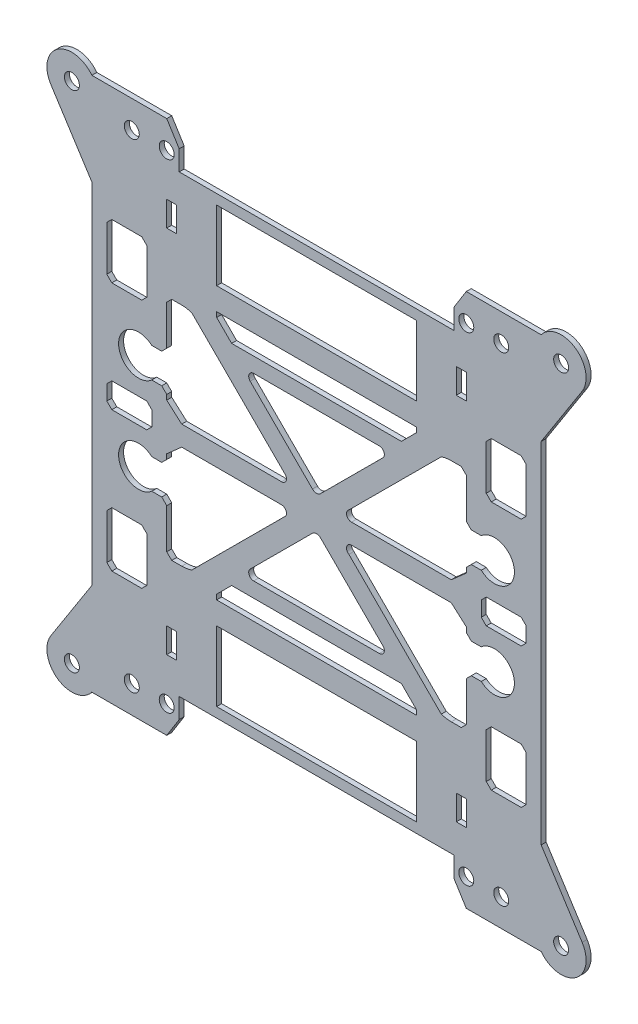
from build123d import *

# Parameters (mm, degrees)
CROQUIS1_R              = 1.5
CROQUIS1_W              = 2
CROQUIS1_H              = 5
SALIENTE_EXTRUIR1_DEPTH = 1
SIMETR_A1_OUTLINE_R     = 1.5
SIMETR_A1_OUTLINE_W     = 2
SIMETR_A1_OUTLINE_H     = 5
SIMETR_A1_OUTLINE_W_2   = 40
SIMETR_A1_OUTLINE_H_2   = 14
SIMETR_A1_DEPTH         = 1


# Read off the part's stored shape, not the designer's step: Simetría1
with BuildPart() as part:
    # Croquis1 → Saliente-Extruir1 (new body)
    with BuildSketch(Plane.XY):
        with BuildLine():
            Line((57.948777513, 9.552803084), (85.448777513, 9.552803084))
            Line((85.448777513, 9.552803084), (85.448777513, 5.552803084))
            Line((85.448777513, 5.552803084), (87.948777513, 1.552803084))
            Line((87.948777513, 1.552803084), (102.948777513, 1.552803084))
            ThreePointArc((102.948777513, 1.552803084), (109.800229319, 0.445587166), (111.157695524, 7.2518787))
            Line((111.157695524, 7.2518787), (102.948777513, 20.052803084))
            Line((102.948777513, 20.052803084), (102.948777513, 55.052803084))
            Line((102.948777513, 55.052803084), (99.948777513, 55.052803084))
            Line((99.948777513, 55.052803084), (99.948777513, 53.552803084))
            Line((99.948777513, 53.552803084), (98.948777513, 52.552803084))
            Line((98.948777513, 52.552803084), (91.948777513, 52.552803084))
            Line((91.948777513, 52.552803084), (90.948777513, 53.552803084))
            Line((90.948777513, 53.552803084), (90.948777513, 55.052803084))
            Line((90.948777513, 55.052803084), (57.948777513, 55.052803084))
            Line((57.948777513, 55.052803084), (57.948777513, 52.052803084))
            Line((57.948777513, 52.052803084), (57.948777513, 51.552803084))
            ThreePointArc((57.948777513, 51.552803084), (58.384311078, 51.466281891), (58.753703167, 51.219857688))
            Line((58.753703167, 51.219857688), (71.237594793, 38.76060809))
            ThreePointArc((71.237594793, 38.76060809), (71.455255379, 37.670576061), (70.531186927, 37.052803084))
            Line((70.531186927, 37.052803084), (57.948777513, 37.052803084))
            Line((57.948777513, 37.052803084), (57.948777513, 34.052803084))
            Line((57.948777513, 34.052803084), (74.948777513, 34.052803084))
            Line((74.948777513, 34.052803084), (77.948777513, 31.052803084))
            Line((77.948777513, 31.052803084), (77.948777513, 30.052803084))
            Line((77.948777513, 30.052803084), (57.948777513, 30.052803084))
            Line((57.948777513, 30.052803084), (57.948777513, 25.552803084))
            Line((57.948777513, 25.552803084), (77.948777513, 25.552803084))
            Line((77.948777513, 25.552803084), (77.948777513, 11.552803084))
            Line((77.948777513, 11.552803084), (57.948777513, 11.552803084))
            Line((57.948777513, 11.552803084), (57.948777513, 9.552803084))
        make_face()
        with Locations((87.948777513, 7.052803084)):
            Circle(CROQUIS1_R, mode=Mode.SUBTRACT)
        with Locations((94.948777513, 7.052803084)):
            Circle(CROQUIS1_R, mode=Mode.SUBTRACT)
        with Locations((106.948777513, 4.552803084)):
            Circle(CROQUIS1_R, mode=Mode.SUBTRACT)
        with BuildLine():
            Line((64.948777513, 53.052803084), (84.948777513, 53.052803084))
            Line((84.948777513, 53.052803084), (87.948777513, 50.407051773))
            Line((87.948777513, 50.407051773), (87.948777513, 49.407051773))
            Line((87.948777513, 49.407051773), (88.948777513, 48.407051773))
            Line((88.948777513, 48.407051773), (90.948777513, 48.407051773))
            ThreePointArc((90.948777513, 48.407051773), (97.594528824, 45.407051773), (90.948777513, 42.407051773))
            Line((90.948777513, 42.407051773), (88.948777513, 42.407051773))
            Line((88.948777513, 42.407051773), (87.948777513, 41.407051773))
            Line((87.948777513, 41.407051773), (87.948777513, 33.407051773))
            Line((87.948777513, 33.407051773), (86.948777513, 32.407051773))
            Line((86.948777513, 32.407051773), (84.948777513, 32.407051773))
            ThreePointArc((84.948777513, 32.407051773), (83.929476852, 32.489760934), (82.936845688, 32.735724374))
            Line((82.936845688, 32.735724374), (72.293713741, 43.35784778))
            Line((72.293713741, 43.35784778), (67.241774681, 48.399814787))
            Line((67.241774681, 48.399814787), (64.416148734, 51.219863215))
            ThreePointArc((64.416148734, 51.219863215), (63.994397874, 52.336276072), (64.948777513, 53.052803084))
        make_face(mode=Mode.SUBTRACT)
        Polygon((91.948777513, 34.552803084), (92.948777513, 35.552803084), (98.948777513, 35.552803084), (99.948777513, 34.552803084), (99.948777513, 25.552803084), (98.948777513, 24.552803084), (92.948777513, 24.552803084), (91.948777513, 25.552803084), align=None, mode=Mode.SUBTRACT)
        with Locations((86.948777513, 18.052803084)):
            Rectangle(CROQUIS1_W, CROQUIS1_H, mode=Mode.SUBTRACT)
    extrude(amount=SALIENTE_EXTRUIR1_DEPTH)

    # Simetría1 outline → Simetría1 (add)
    with BuildSketch(Plane.XY):
        with BuildLine():
            Line((90.948777513, 55.052803084), (90.948777513, 56.552803084))
            Line((90.948777513, 56.552803084), (91.948777513, 57.552803084))
            Line((91.948777513, 57.552803084), (98.948777513, 57.552803084))
            Line((98.948777513, 57.552803084), (99.948777513, 56.552803084))
            Line((99.948777513, 56.552803084), (99.948777513, 55.052803084))
            Line((99.948777513, 55.052803084), (102.948777513, 55.052803084))
            Line((102.948777513, 55.052803084), (102.948777513, 90.052803084))
            Line((102.948777513, 90.052803084), (111.157695524, 102.853727468))
            ThreePointArc((111.157695524, 102.853727468), (109.800229319, 109.660019002), (102.948777513, 108.552803084))
            Line((102.948777513, 108.552803084), (87.948777513, 108.552803084))
            Line((87.948777513, 108.552803084), (85.448777513, 104.552803084))
            Line((85.448777513, 104.552803084), (85.448777513, 100.552803084))
            Line((85.448777513, 100.552803084), (30.448777513, 100.552803084))
            Line((30.448777513, 100.552803084), (30.448777513, 104.552803084))
            Line((30.448777513, 104.552803084), (27.948777513, 108.552803084))
            Line((27.948777513, 108.552803084), (12.948777513, 108.552803084))
            ThreePointArc((12.948777513, 108.552803084), (6.097325707, 109.660019002), (4.739859502, 102.853727468))
            Line((4.739859502, 102.853727468), (12.948777513, 90.052803084))
            Line((12.948777513, 90.052803084), (12.948777513, 20.052803084))
            Line((12.948777513, 20.052803084), (4.739859502, 7.2518787))
            ThreePointArc((4.739859502, 7.2518787), (6.097325707, 0.445587166), (12.948777513, 1.552803084))
            Line((12.948777513, 1.552803084), (27.948777513, 1.552803084))
            Line((27.948777513, 1.552803084), (30.448777513, 5.552803084))
            Line((30.448777513, 5.552803084), (30.448777513, 9.552803084))
            Line((30.448777513, 9.552803084), (57.948777513, 9.552803084))
            Line((57.948777513, 9.552803084), (57.948777513, 11.552803084))
            Line((57.948777513, 11.552803084), (37.948777513, 11.552803084))
            Line((37.948777513, 11.552803084), (37.948777513, 25.552803084))
            Line((37.948777513, 25.552803084), (57.948777513, 25.552803084))
            Line((57.948777513, 25.552803084), (57.948777513, 30.052803084))
            Line((57.948777513, 30.052803084), (37.948777513, 30.052803084))
            Line((37.948777513, 30.052803084), (37.948777513, 31.052803084))
            Line((37.948777513, 31.052803084), (40.948777513, 34.052803084))
            Line((40.948777513, 34.052803084), (57.948777513, 34.052803084))
            Line((57.948777513, 34.052803084), (57.948777513, 37.052803084))
            Line((57.948777513, 37.052803084), (45.366368099, 37.052803084))
            ThreePointArc((45.366368099, 37.052803084), (44.442299648, 37.670576061), (44.659960233, 38.76060809))
            Line((44.659960233, 38.76060809), (57.143851859, 51.219857688))
            ThreePointArc((57.143851859, 51.219857688), (57.513243948, 51.466281891), (57.948777513, 51.552803084))
            Line((57.948777513, 51.552803084), (57.948777513, 55.052803084))
            Line((57.948777513, 55.052803084), (90.948777513, 55.052803084))
        make_face()
        with Locations((8.948777513, 4.552803084)):
            Circle(SIMETR_A1_OUTLINE_R, mode=Mode.SUBTRACT)
        with Locations((20.948777513, 7.052803084)):
            Circle(SIMETR_A1_OUTLINE_R, mode=Mode.SUBTRACT)
        with Locations((27.948777513, 7.052803084)):
            Circle(SIMETR_A1_OUTLINE_R, mode=Mode.SUBTRACT)
        with Locations((28.948777513, 18.052803084)):
            Rectangle(SIMETR_A1_OUTLINE_W, SIMETR_A1_OUTLINE_H, mode=Mode.SUBTRACT)
        Polygon((22.948777513, 24.552803084), (16.948777513, 24.552803084), (15.948777513, 25.552803084), (15.948777513, 34.552803084), (16.948777513, 35.552803084), (22.948777513, 35.552803084), (23.948777513, 34.552803084), (23.948777513, 25.552803084), align=None, mode=Mode.SUBTRACT)
        Polygon((24.948777513, 53.552803084), (23.948777513, 52.552803084), (16.948777513, 52.552803084), (15.948777513, 53.552803084), (15.948777513, 56.552803084), (16.948777513, 57.552803084), (23.948777513, 57.552803084), (24.948777513, 56.552803084), align=None, mode=Mode.SUBTRACT)
        with BuildLine():
            Line((30.948777513, 32.407051773), (28.948777513, 32.407051773))
            Line((28.948777513, 32.407051773), (27.948777513, 33.407051773))
            Line((27.948777513, 33.407051773), (27.948777513, 41.407051773))
            Line((27.948777513, 41.407051773), (26.948777513, 42.407051773))
            Line((26.948777513, 42.407051773), (24.948777513, 42.407051773))
            ThreePointArc((24.948777513, 42.407051773), (18.303026202, 45.407051773), (24.948777513, 48.407051773))
            Line((24.948777513, 48.407051773), (26.948777513, 48.407051773))
            Line((26.948777513, 48.407051773), (27.948777513, 49.407051773))
            Line((27.948777513, 49.407051773), (27.948777513, 50.407051773))
            Line((27.948777513, 50.407051773), (30.948777513, 53.052803084))
            Line((30.948777513, 53.052803084), (50.948777513, 53.052803084))
            ThreePointArc((50.948777513, 53.052803084), (51.903157152, 52.336276072), (51.481406293, 51.219863215))
            Line((51.481406293, 51.219863215), (32.960709338, 32.735724374))
            ThreePointArc((32.960709338, 32.735724374), (31.968078174, 32.489760934), (30.948777513, 32.407051773))
        make_face(mode=Mode.SUBTRACT)
        Polygon((23.948777513, 75.552803084), (22.948777513, 74.552803084), (16.948777513, 74.552803084), (15.948777513, 75.552803084), (15.948777513, 84.552803084), (16.948777513, 85.552803084), (22.948777513, 85.552803084), (23.948777513, 84.552803084), align=None, mode=Mode.SUBTRACT)
        with BuildLine():
            ThreePointArc((51.481406293, 58.885742953), (51.903157152, 57.769330096), (50.948777513, 57.052803084))
            Line((50.948777513, 57.052803084), (30.948777513, 57.052803084))
            Line((30.948777513, 57.052803084), (27.948777513, 59.698554395))
            Line((27.948777513, 59.698554395), (27.948777513, 60.698554395))
            Line((27.948777513, 60.698554395), (26.948777513, 61.698554395))
            Line((26.948777513, 61.698554395), (24.948777513, 61.698554395))
            ThreePointArc((24.948777513, 61.698554395), (18.303026202, 64.698554395), (24.948777513, 67.698554395))
            Line((24.948777513, 67.698554395), (26.948777513, 67.698554395))
            Line((26.948777513, 67.698554395), (27.948777513, 68.698554395))
            Line((27.948777513, 68.698554395), (27.948777513, 76.698554395))
            Line((27.948777513, 76.698554395), (28.948777513, 77.698554395))
            Line((28.948777513, 77.698554395), (30.948777513, 77.698554395))
            ThreePointArc((30.948777513, 77.698554395), (31.968078174, 77.615845234), (32.960709338, 77.369881793))
            Line((32.960709338, 77.369881793), (51.481406293, 58.885742953))
        make_face(mode=Mode.SUBTRACT)
        with Locations((28.948777513, 92.052803084)):
            Rectangle(SIMETR_A1_OUTLINE_W, SIMETR_A1_OUTLINE_H, mode=Mode.SUBTRACT)
        with Locations((8.948777513, 105.552803084)):
            Circle(SIMETR_A1_OUTLINE_R, mode=Mode.SUBTRACT)
        with Locations((20.948777513, 103.052803084)):
            Circle(SIMETR_A1_OUTLINE_R, mode=Mode.SUBTRACT)
        with Locations((27.948777513, 103.052803084)):
            Circle(SIMETR_A1_OUTLINE_R, mode=Mode.SUBTRACT)
        with BuildLine():
            ThreePointArc((44.659960233, 71.344998078), (44.442299648, 72.435030107), (45.366368099, 73.052803084))
            Line((45.366368099, 73.052803084), (70.531186927, 73.052803084))
            ThreePointArc((70.531186927, 73.052803084), (71.455255379, 72.435030107), (71.237594793, 71.344998078))
            Line((71.237594793, 71.344998078), (58.753703167, 58.885748479))
            ThreePointArc((58.753703167, 58.885748479), (57.948777513, 58.552803084), (57.143851859, 58.885748479))
            Line((57.143851859, 58.885748479), (44.659960233, 71.344998078))
        make_face(mode=Mode.SUBTRACT)
        with BuildLine():
            Line((87.948777513, 60.698554395), (87.948777513, 59.698554395))
            Line((87.948777513, 59.698554395), (84.948777513, 57.052803084))
            Line((84.948777513, 57.052803084), (64.948777513, 57.052803084))
            ThreePointArc((64.948777513, 57.052803084), (63.994397874, 57.769330096), (64.416148734, 58.885742953))
            Line((64.416148734, 58.885742953), (82.936845688, 77.369881793))
            ThreePointArc((82.936845688, 77.369881793), (83.929476852, 77.615845234), (84.948777513, 77.698554395))
            Line((84.948777513, 77.698554395), (86.948777513, 77.698554395))
            Line((86.948777513, 77.698554395), (87.948777513, 76.698554395))
            Line((87.948777513, 76.698554395), (87.948777513, 68.698554395))
            Line((87.948777513, 68.698554395), (88.948777513, 67.698554395))
            Line((88.948777513, 67.698554395), (90.948777513, 67.698554395))
            ThreePointArc((90.948777513, 67.698554395), (97.594528824, 64.698554395), (90.948777513, 61.698554395))
            Line((90.948777513, 61.698554395), (88.948777513, 61.698554395))
            Line((88.948777513, 61.698554395), (87.948777513, 60.698554395))
        make_face(mode=Mode.SUBTRACT)
        Polygon((37.948777513, 80.052803084), (77.948777513, 80.052803084), (77.948777513, 79.052803084), (74.948777513, 76.052803084), (40.948777513, 76.052803084), (37.948777513, 79.052803084), align=None, mode=Mode.SUBTRACT)
        Polygon((99.948777513, 84.552803084), (99.948777513, 75.552803084), (98.948777513, 74.552803084), (92.948777513, 74.552803084), (91.948777513, 75.552803084), (91.948777513, 84.552803084), (92.948777513, 85.552803084), (98.948777513, 85.552803084), align=None, mode=Mode.SUBTRACT)
        with Locations((57.948777513, 91.552803084)):
            Rectangle(SIMETR_A1_OUTLINE_W_2, SIMETR_A1_OUTLINE_H_2, mode=Mode.SUBTRACT)
        with Locations((86.948777513, 92.052803084)):
            Rectangle(SIMETR_A1_OUTLINE_W, SIMETR_A1_OUTLINE_H, mode=Mode.SUBTRACT)
        with Locations((87.948777513, 103.052803084)):
            Circle(SIMETR_A1_OUTLINE_R, mode=Mode.SUBTRACT)
        with Locations((94.948777513, 103.052803084)):
            Circle(SIMETR_A1_OUTLINE_R, mode=Mode.SUBTRACT)
        with Locations((106.948777513, 105.552803084)):
            Circle(SIMETR_A1_OUTLINE_R, mode=Mode.SUBTRACT)
    extrude(amount=SIMETR_A1_DEPTH)


solid = part.part
